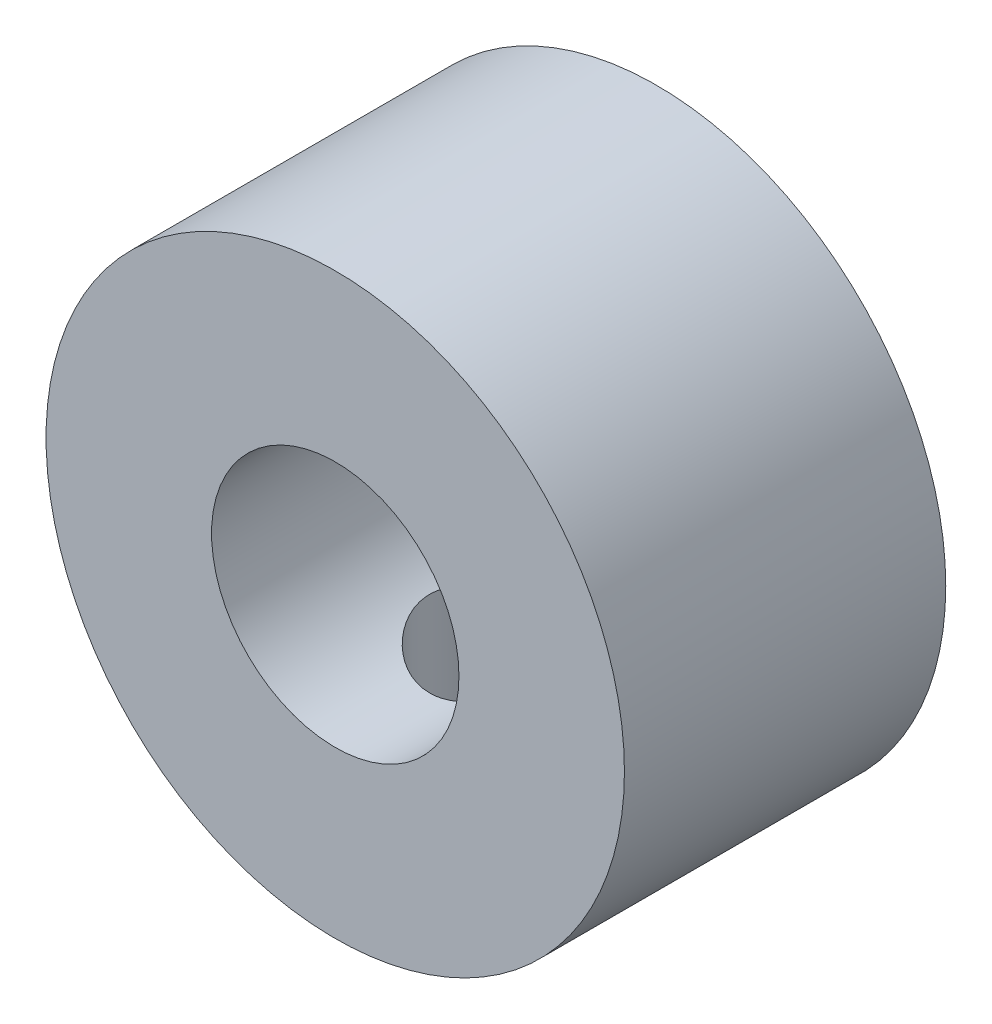
from build123d import *

# Parameters (mm, degrees)
SKETCH_1_R          = 3.6
SKETCH_1_R_2        = 1.54
EXTRUDE_1_DEPTH     = 4
CUT_EXTRUDE_1_REACH = 8.475
SKETCH_2_R          = 0.825


with BuildPart() as part:
    # 草图1 → 凸台-拉伸1 (new body)
    with BuildSketch(Plane.XY):
        Circle(SKETCH_1_R)
        Circle(SKETCH_1_R_2, mode=Mode.SUBTRACT)
    extrude(amount=EXTRUDE_1_DEPTH)

    # 草图2 → 切除-拉伸1 (cut, up to next)
    with BuildSketch(Plane(origin=(0, 0, 0), x_dir=(1, 0, 0), z_dir=(0, 1, 0)), mode=Mode.PRIVATE) as cut_extrude_1_sk1:
        with Locations((0, -2)):
            Circle(SKETCH_2_R)
    cut_extrude_1_tool1 = extrude(cut_extrude_1_sk1.sketch, amount=-CUT_EXTRUDE_1_REACH, mode=Mode.PRIVATE) & part.part
    add(cut_extrude_1_tool1.solids().sort_by_distance((0, 0, 2))[0], mode=Mode.SUBTRACT)


solid = part.part
